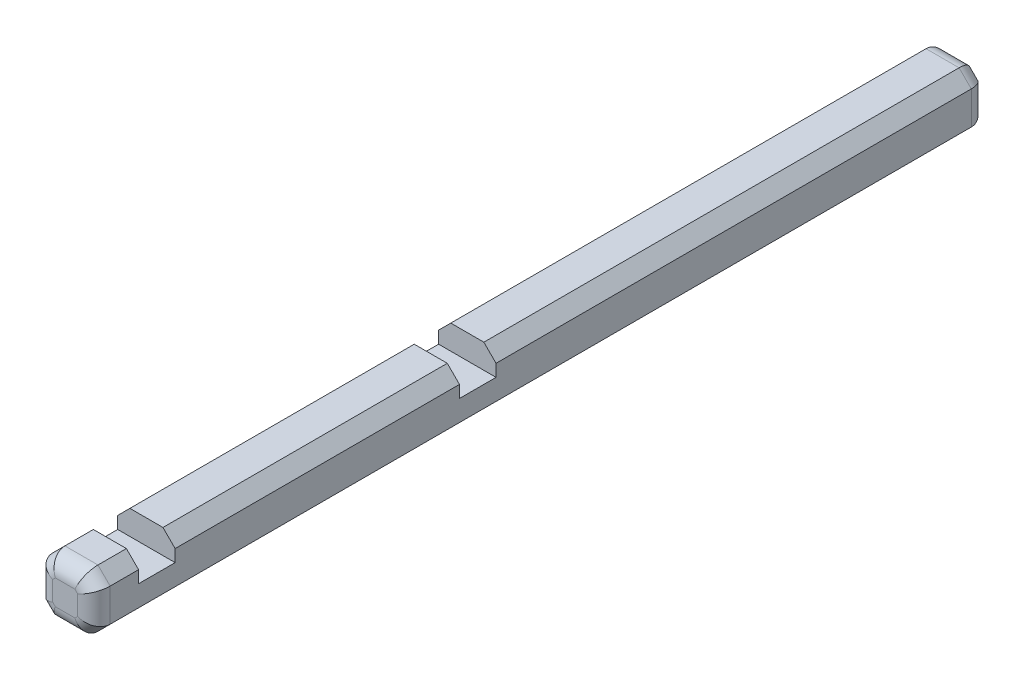
from build123d import *

# Parameters (mm, degrees)
SKETCH1_W           = 7.071067812
SKETCH1_H           = 7.071067812
BOSS_EXTRUDE1_DEPTH = 110
CHAMFER2_SIZE       = 1.5
SKETCH3_W           = 7.071067812
SKETCH3_H           = 3
CUT_EXTRUDE1_DEPTH  = 4.5
SKETCH4_W           = 7.071067812
SKETCH4_H           = 3
CUT_EXTRUDE2_DEPTH  = 4.5
FILLET1_R           = 2


with BuildPart() as part:
    # Sketch1 → Boss-Extrude1 (new body)
    with BuildSketch(Plane.XY):
        Rectangle(SKETCH1_W, SKETCH1_H)
    extrude(amount=BOSS_EXTRUDE1_DEPTH)

    # Chamfer2
    chamfer2_edges = [part.edges().sort_by_distance(p)[0] for p in [
        (3.535533906, -3.535533906, 55),
        (-3.535533906, -3.535533906, 55),
        (3.535533906, 3.535533906, 55),
        (-3.535533906, 3.535533906, 55),
    ]]
    chamfer(chamfer2_edges, length=CHAMFER2_SIZE)

    # Sketch3 → Cut-Extrude1 (cut)
    with BuildSketch(Plane(origin=(0, 0, 65), x_dir=(-1, 0, 0), z_dir=(0, 0, -1))):
        with Locations((0, 2.035533906)):
            Rectangle(SKETCH3_W, SKETCH3_H)
    extrude(amount=CUT_EXTRUDE1_DEPTH, mode=Mode.SUBTRACT)

    # Sketch4 → Cut-Extrude2 (cut)
    with BuildSketch(Plane(origin=(0, 0, 104.5), x_dir=(-1, 0, 0), z_dir=(0, 0, -1))):
        with Locations((0, 2.035533906)):
            Rectangle(SKETCH4_W, SKETCH4_H)
    extrude(amount=CUT_EXTRUDE2_DEPTH, mode=Mode.SUBTRACT)

    # Fillet1
    fillet1_edges = [part.edges().sort_by_distance(p)[0] for p in [
        (0, 3.535533906, 0),
        (-3.535533906, 0, 0),
        (0, -3.535533906, 0),
        (3.535533906, 0, 0),
        (-3.535533906, 0, 110),
        (0, 3.535533906, 110),
        (3.535533906, 0, 110),
        (0, -3.535533906, 110),
        (2.785533906, 2.785533906, 0),
        (-2.785533906, 2.785533906, 0),
        (-2.785533906, -2.785533906, 0),
        (2.785533906, -2.785533906, 0),
        (-2.785533906, -2.785533906, 110),
        (-2.785533906, 2.785533906, 110),
        (2.785533906, 2.785533906, 110),
        (2.785533906, -2.785533906, 110),
    ]]
    fillet(fillet1_edges, radius=FILLET1_R)


solid = part.part
